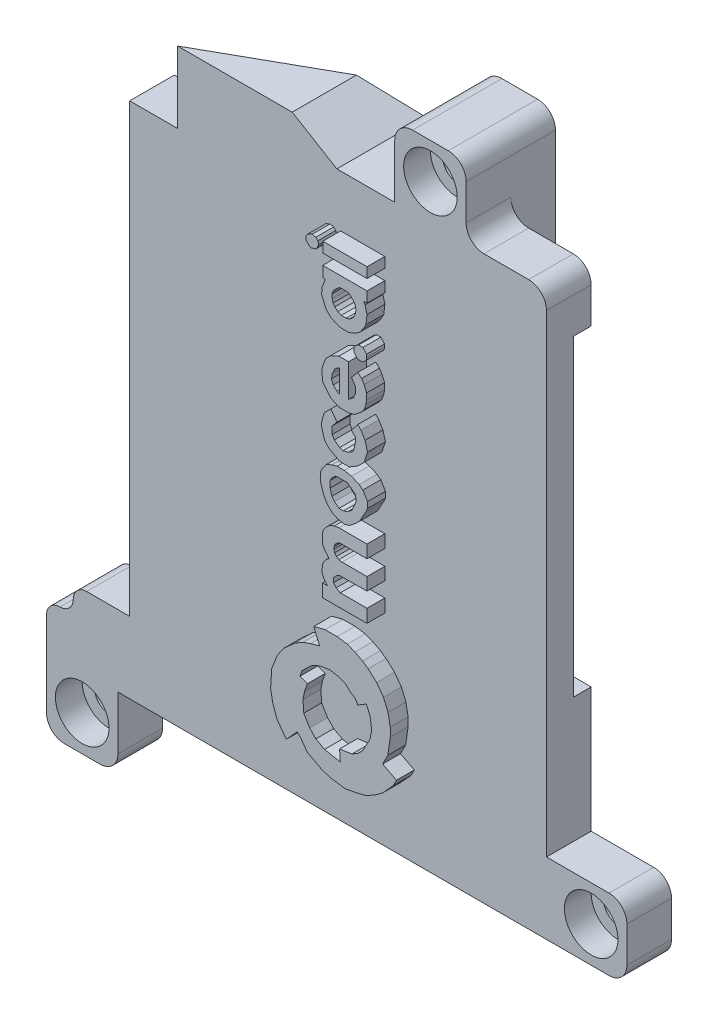
from build123d import *

# Parameters (mm, degrees)
EXTRUDE_1_DEPTH      = 5
SKETCH_2_R           = 1.6
CUT_EXTRUDE_1_DEPTH  = 50.409007276
EXTRUDE_2_DEPTH      = 5
CUT_EXTRUDE_2_DEPTH  = 75.411020689
SKETCH_5_W           = 15.712723141
SKETCH_5_H           = 8
EXTRUDE_3_DEPTH      = 5.633558
CUT_EXTRUDE_3_DEPTH  = 8
SKETCH_7_W           = 0.3
SKETCH_7_H           = 50
CUT_EXTRUDE_4_DEPTH  = 51.162236792
SKETCH_8_W           = 9
SKETCH_8_H           = 5
EXTRUDE_4_DEPTH      = 55
FILLET_1_R           = 2
SKETCH_9_R           = 3
CUT_EXTRUDE_5_DEPTH  = 3
SKETCH_10_R          = 1.6
CUT_EXTRUDE_6_DEPTH  = 50.409007276
SKETCH_11_W          = 8
SKETCH_11_H          = 8
CUT_EXTRUDE_7_DEPTH  = 51.162236792
SKETCH_12_R          = 1.6
EXTRUDE_5_DEPTH      = 5
SKETCH_13_R          = 3
CUT_EXTRUDE_8_DEPTH  = 3
FILLET_2_R           = 2
SKETCH_14_W          = 8.860172008
SKETCH_14_H          = 9.168054433
CUT_EXTRUDE_9_DEPTH  = 57.109268397
FILLET_3_R           = 1.5
SKETCH_17_W          = 4.955155642
SKETCH_17_H          = 1.145782212
EXTRUDE_6_DEPTH      = 2
SKETCH_18_W          = 2
SKETCH_18_H          = 35
CUT_EXTRUDE_10_DEPTH = 72.254824398


with BuildPart() as part:
    # 草图1 → 凸台-拉伸1 (new body)
    with BuildSketch(Plane.XY):
        Polygon((-34, -35.5), (-34, -27.5), (-21.979228204, -27.5), (-21.979228204, 22.5), (-6.266505063, 22.5), (-6.266505063, 30.5), (-3.479228204, 30.5), (1.520771796, 27.5), (8, 27.5), (8, 35.5), (16, 35.5), (16, 22.5), (16, -27.5), (34, -27.5), (34, -35.5), align=None)
    extrude(amount=EXTRUDE_1_DEPTH)

    # 草图2 → 切除-拉伸1 (cut, through all)
    with BuildSketch(Plane.XY.offset(5)):
        with Locations((12, 31.5)):
            Circle(SKETCH_2_R)
        with Locations((30, -31.5)):
            Circle(SKETCH_2_R)
        with Locations((-30, -31.5)):
            Circle(SKETCH_2_R)
    extrude(amount=-CUT_EXTRUDE_1_DEPTH, mode=Mode.SUBTRACT)

    # 草图3 → 凸台-拉伸2 (add)
    with BuildSketch(Plane(origin=(0, 0, 0), x_dir=(-1, 0, 0), z_dir=(0, 0, -1))):
        Polygon((-8, 35.5), (-8, 27.5), (-1.520771796, 27.5), (3.479228204, 30.5), (6.266505063, 30.5), (6.266505063, 22.5), (-16, 22.5), (-16, 35.5), align=None)
    extrude(amount=EXTRUDE_2_DEPTH)

    # 草图4 → 切除-拉伸2 (cut, through all)
    with BuildSketch(Plane(origin=(0, 30.5, 0), x_dir=(1, 0, 0), z_dir=(0, 1, 0))):
        Polygon((-6.266505063, 5), (1.520771796, 5), (-6.266505063, 0.633557637), align=None)
    extrude(amount=-CUT_EXTRUDE_2_DEPTH, mode=Mode.SUBTRACT)

    # 草图5 → 凸台-拉伸3 (add)
    with BuildSketch(Plane.XY.offset(5)):
        with Locations((-14.122866634, 26.5)):
            Rectangle(SKETCH_5_W, SKETCH_5_H)
    extrude(amount=-EXTRUDE_3_DEPTH)

    # 草图6 → 切除-拉伸3 (cut)
    with BuildSketch(Plane(origin=(0, 30.5, 0), x_dir=(1, 0, 0), z_dir=(0, 1, 0))):
        Polygon((-6.266505063, 0.633557637), (-16.313602761, -5), (-21.979228204, -5), (-21.979228204, 0.633557637), align=None)
    extrude(amount=-CUT_EXTRUDE_3_DEPTH, mode=Mode.SUBTRACT)

    # 草图7 → 切除-拉伸4 (cut, through all)
    with BuildSketch(Plane.XY.offset(5)):
        with Locations((-21.829228204, -2.5)):
            Rectangle(SKETCH_7_W, SKETCH_7_H)
    extrude(amount=-CUT_EXTRUDE_4_DEPTH, mode=Mode.SUBTRACT)

    # 草图8 → 凸台-拉伸4 (add)
    with BuildSketch(Plane(origin=(0, -27.5, 0), x_dir=(1, 0, 0), z_dir=(0, 1, 0))):
        with Locations((20.5, -2.5)):
            Rectangle(SKETCH_8_W, SKETCH_8_H)
    extrude(amount=EXTRUDE_4_DEPTH)

    # 圆角1
    fillet_1_edges = [part.edges().sort_by_distance(p)[0] for p in [
        (16, 27.5, 2.5),
        (25, 27.5, 2.5),
        (-34, -35.5, 2.5),
        (-34, -27.5, 2.5),
        (8, 35.5, 0),
        (16, 35.5, 0),
        (34, -27.5, 2.5),
        (34, -35.5, 2.5),
    ]]
    fillet(fillet_1_edges, radius=FILLET_1_R)

    # 草图9 → 切除-拉伸5 (cut)
    with BuildSketch(Plane.XY.offset(5)):
        with Locations((12, 31.5)):
            Circle(SKETCH_9_R)
        with Locations((30, -31.5)):
            Circle(SKETCH_9_R)
        with Locations((-30, -31.5)):
            Circle(SKETCH_9_R)
    extrude(amount=-CUT_EXTRUDE_5_DEPTH, mode=Mode.SUBTRACT)

    # 草图10 → 切除-拉伸6 (cut, through all)
    with BuildSketch(Plane.XY):
        with Locations((12, 31.5)):
            Circle(SKETCH_10_R)
    extrude(amount=-CUT_EXTRUDE_6_DEPTH, mode=Mode.SUBTRACT)

    # 草图11 → 切除-拉伸7 (cut, through all)
    with BuildSketch(Plane.XY.offset(5)):
        with Locations((-30, -31.5)):
            Rectangle(SKETCH_11_W, SKETCH_11_H)
    extrude(amount=-CUT_EXTRUDE_7_DEPTH, mode=Mode.SUBTRACT)

    # 草图12 → 凸台-拉伸5 (add)
    with BuildSketch(Plane.XY.offset(5)):
        Polygon((-26, -27.5), (-31, -27.5), (-31, -35.5), (-31, -43.5), (-23, -43.5), (-23, -35.5), (-26, -35.5), align=None)
        with Locations((-27, -39.5)):
            Circle(SKETCH_12_R, mode=Mode.SUBTRACT)
    extrude(amount=-EXTRUDE_5_DEPTH)

    # 草图13 → 切除-拉伸8 (cut)
    with BuildSketch(Plane.XY.offset(5)):
        with Locations((-27, -39.5)):
            Circle(SKETCH_13_R)
    extrude(amount=-CUT_EXTRUDE_8_DEPTH, mode=Mode.SUBTRACT)

    # 圆角2
    fillet_2_edges = [part.edges().sort_by_distance(p)[0] for p in [
        (-23, -43.5, 2.5),
        (-31, -43.5, 2.5),
        (-31, -27.5, 2.5),
    ]]
    fillet(fillet_2_edges, radius=FILLET_2_R)

    # 草图14 → 切除-拉伸9 (cut, through all)
    with BuildSketch(Plane.XY.offset(5)):
        with Locations((-32.430086004, -25.915972784)):
            Rectangle(SKETCH_14_W, SKETCH_14_H)
    extrude(amount=-CUT_EXTRUDE_9_DEPTH, mode=Mode.SUBTRACT)

    # 圆角3
    fillet_3_edges = [part.edges().sort_by_distance(p)[0] for p in [
        (-28, -27.5, 2.5),
        (-28, -30.5, 2.5),
        (-31, -30.5, 2.5),
    ]]
    fillet(fillet_3_edges, radius=FILLET_3_R - 0.0001)  # a hair under: the kernel refuses the full size

    # 草图17 → 凸台-拉伸6 (add)
    # profile 1 of 9: a face of its own
    with BuildSketch(Plane.XY.offset(5)):
        Polygon((1.916725491, -12.893336586), (6.896323701, -12.893336586), (6.896323701, -11.425665534), (3.908564775, -11.425665534), (3.436813366, -11.181053693), (3.157256975, -10.81413593), (3.157256975, -10.307439971), (3.401851814, -10.062845132), (3.609235388, -9.855461559), (3.856081017, -9.787813418), (6.896323701, -9.760466133), (6.896323701, -8.352080986), (4.097648696, -8.352080986), (3.732658202, -8.297386418), (3.468661155, -8.12418695), (3.279554395, -7.846156225), (3.196343161, -7.542521431), (3.196343161, -7.299210537), (3.327366852, -7.002948289), (3.54844414, -6.781871001), (3.827670109, -6.629325934), (4.270600773, -6.629325934), (6.896323701, -6.629325934), (6.896323701, -5.196364207), (3.763688789, -5.196364207), (3.261855006, -5.251539885), (2.770526588, -5.468564218), (2.47188533, -5.70531219), (2.208746178, -5.968451342), (2.037497209, -6.229475367), (1.916725491, -6.598417429), (1.916725491, -7.64573516), (2.087613264, -8.032613526), (2.319191646, -8.324733702), (2.55250635, -8.619044128), (2.644073756, -8.734550102), (2.319191646, -8.99210052), (2.087613264, -9.291819658), (1.950419501, -9.602033272), (1.881365905, -10.062845132), (1.881365905, -10.543601194), (1.992752729, -10.795773434), (2.136693517, -11.059249708), (2.319191646, -11.289458526), (2.481632701, -11.451899581), (1.937059317, -11.451899581), align=None)
    # profile 2 of 9: a face of its own
    with BuildSketch(Plane.XY.offset(5)):
        Polygon((1.689539286, -1.386065269), (1.689539286, -0.822293818), (1.916725491, -0.308595149), (2.340315754, 0.239634385), (2.96296205, 0.514663046), (3.54844414, 0.675114642), (4.367309759, 0.675114642), (5.160011728, 0.514663046), (5.601366876, 0.319471182), (6.016149805, 0.136031035), (6.436098366, -0.188442767), (6.705339108, -0.637614597), (6.95556609, -1.055065946), (6.95556609, -1.717064592), (6.775331396, -2.12459956), (6.296104273, -2.976689803), (6.051760196, -3.411146024), (5.674152379, -3.788753841), (4.922747903, -4.384430029), (4.367309759, -4.536648069), (3.574830934, -4.376241641), (3.016190797, -4.129179811), (2.47188533, -3.584874344), (2.037497209, -2.860188678), (1.803132388, -2.12459956), (1.65321642, -1.577561596), align=None)
        Polygon((3.261855006, -0.452935376), (2.892496564, -0.822293818), (2.770526588, -1.098084393), (2.770526588, -1.830858835), (2.96296205, -2.533048901), (3.261855006, -2.910081774), (3.763688789, -3.297824299), (4.270600773, -3.297824299), (4.685484077, -3.184125368), (5.208815427, -2.769254239), (5.46855241, -2.181953868), (5.674152379, -1.717064592), (5.601366876, -1.055065946), (5.160011728, -0.714052317), (4.685484077, -0.34740791), (4.049135441, -0.34740791), (3.437905496, -0.34740791), align=None, mode=Mode.SUBTRACT)
    # profile 3 of 9: a face of its own
    with BuildSketch(Plane.XY.offset(5)):
        Polygon((3.54844414, 4.961813382), (2.831511576, 5.866174424), (2.128520622, 5.163183471), (1.916725491, 4.516176589), (1.777120035, 3.780168243), (1.98404045, 3.025123105), (2.173300936, 2.4311007), (2.651638902, 1.952762735), (3.827670109, 1.291346816), (4.922747903, 1.291346816), (5.862956287, 1.854922684), (6.570718737, 2.562685134), (6.783223226, 3.211859012), (6.95556609, 3.738344293), (6.676970982, 4.754927805), (6.216837512, 5.522564196), (5.862956287, 5.876445421), (5.156264653, 4.961813382), (5.601901446, 4.516176589), (5.601901446, 4.110514016), (5.467633562, 3.402645674), (5.326048934, 2.970122847), (4.829657462, 2.672577899), (4.198496866, 2.499608091), (3.827670109, 2.620996757), (3.239654505, 3.075327777), (2.997901377, 3.478642275), (2.997901377, 4.313345303), align=None)
    # profile 4 of 9: a face of its own
    with BuildSketch(Plane.XY.offset(5)):
        Polygon((5.156264653, 10.095922375), (5.862956287, 10.928313604), (6.296104273, 10.560575396), (6.570718737, 10.102438638), (6.862989177, 9.440758121), (6.862989177, 8.770820487), (6.763633365, 8.247010683), (6.570718737, 7.657681311), (6.216837512, 7.240855056), (5.50961047, 6.680200546), (4.829657462, 6.493859158), (3.827670109, 6.493859158), (2.831511576, 6.934416026), (2.365268166, 7.522549969), (1.941168059, 8.057523038), (1.86274235, 8.770820487), (1.86274235, 9.35426087), (2.066993988, 9.978223351), (2.303111977, 10.512117989), (2.831511576, 11.040517587), (3.189977858, 11.198855479), (3.743520469, 11.443360399), (4.375209006, 11.443360399), (4.829657462, 11.443360399), (4.829657462, 7.790036504), (5.379083049, 8.22559385), (5.601901446, 8.729416315), (5.601901446, 9.440758121), align=None)
        Polygon((3.827670109, 10.331507017), (3.827670109, 7.790036504), (3.54844414, 7.913525802), (3.118777941, 8.343192001), (2.906822115, 8.823045663), (3.012800028, 9.381767583), (3.251345884, 9.921151955), (3.54844414, 10.218250212), align=None, mode=Mode.SUBTRACT)
    # profile 5 of 9: a face of its own
    with BuildSketch(Plane.XY.offset(5)):
        Polygon((6.173932235, 13.637407163), (6.433411505, 13.637407163), (6.602078719, 13.46873995), (6.862989177, 13.207829492), (6.862989177, 12.877095512), (6.805301293, 12.572961528), (6.602078719, 12.369738953), (6.350689369, 12.198746194), (5.862956287, 12.205626466), (5.637759627, 12.430823126), (5.437643783, 12.72502852), (5.437643783, 13.207829492), (5.681976013, 13.452161722), (5.954319304, 13.637407163), align=None)
    # profile 6 of 9: a face of its own
    with BuildSketch(Plane.XY.offset(5)):
        Polygon((1.941168059, 19.352732582), (6.896323701, 19.352732582), (6.896323701, 18.162013399), (6.515265359, 18.162013399), (6.676970982, 17.891950509), (6.763633365, 17.564804989), (6.896323701, 17.063906587), (6.829978533, 16.502262669), (6.770282187, 15.996904244), (6.515265359, 15.52942153), (6.113695785, 14.970386362), (5.681976013, 14.642256058), (5.298450141, 14.481247947), (4.861658728, 14.297878413), (4.097648696, 14.297878413), (3.626743322, 14.38956318), (2.831511576, 14.757261852), (2.303111977, 15.309289662), (2.108039589, 15.773957606), (1.813810013, 16.474820774), (1.86274235, 17.235636709), (2.066993988, 17.710486525), (2.249402045, 18.134553784), (1.964868169, 18.134553784), align=None)
        Polygon((3.189977858, 17.564804989), (3.568902331, 17.943729462), (3.809614068, 18.134553784), (4.059364737, 18.162013399), (4.442061473, 18.162013399), (4.740055905, 18.162013399), (5.050776392, 17.958160274), (5.298450141, 17.710486525), (5.50961047, 17.444122316), (5.617237634, 17.178775797), (5.653227712, 16.851438873), (5.600902946, 16.502262669), (5.404030305, 16.05710706), (5.120880851, 15.773957606), (4.895416148, 15.620598556), (4.562714464, 15.52942153), (4.013083488, 15.537174973), (3.626743322, 15.708036144), (3.286494109, 15.996904244), (3.094149291, 16.279684865), (2.997901377, 16.630890033), (2.948719797, 17.078206304), (3.077175785, 17.368662628), align=None, mode=Mode.SUBTRACT)
    # profile 7 of 9: a face of its own
    with BuildSketch(Plane.XY.offset(5)):
        Polygon((0.753718371, 21.776071394), (1.165680205, 21.695862871), (1.392442696, 21.458960342), (1.482254234, 21.119926942), (1.343801067, 20.798047219), (1.165680205, 20.550080659), (0.930466091, 20.487771336), (0.583214376, 20.395782728), (0.368412321, 20.550080659), (0.080431583, 20.850938904), (0.080431583, 21.289443642), (0.2872865, 21.577411606), (0.518497113, 21.674476203), align=None)
    # profile 8 of 9: a face of its own
    with BuildSketch(Plane.XY.offset(5)):
        with Locations((4.41874588, 21.122971765)):
            Rectangle(SKETCH_17_W, SKETCH_17_H)
    # profile 9 of 9: a face of its own
    with BuildSketch(Plane.XY.offset(5)):
        Polygon((1.588200642, -17.733821336), (0.930466091, -16.173680015), (2.208746178, -15.849494805), (3.54844414, -15.849494805), (4.685484077, -16.01158741), (5.535885857, -16.345903407), (6.402528379, -16.791658071), (7.028433692, -17.227281946), (7.970596958, -18.088398909), (8.740536831, -19.131870053), (9.247390739, -20.334123644), (9.500345916, -21.654436216), (9.500345916, -22.609486509), (9.391406404, -23.373670514), (9.22746164, -24.523702895), (8.644063606, -25.657953604), (10.194567977, -26.455450307), (9.826681153, -27.170701073), (9.288856787, -27.759144203), (8.644063606, -28.464623801), (7.897459776, -29.015515947), (6.796699595, -29.647827015), (5.862956287, -29.884634091), (4.46847195, -30.151799639), (2.96296205, -29.937179191), (1.916725491, -29.647827015), (0.224421952, -28.740069874), (-0.576882963, -27.654090844), (-0.931828748, -27.32967803), (-2.140581327, -28.652195557), (-3.171938882, -27.25443466), (-3.653960445, -25.897918766), (-3.899272874, -24.617497915), (-3.776616659, -22.609486509), (-3.150308448, -21.016342233), (-2.420080075, -19.96714855), (-1.650811541, -19.266214882), (-1.180554257, -18.837731006), (-0.270702691, -18.315083817), (0.583214376, -18.011654685), align=None)
        Polygon((-0.616713743, -21.777379466), (0.224421952, -22.082177076), (-0.098198742, -22.972498305), (-0.270702691, -23.858501938), (-0.184450717, -25.140103568), (0.475813349, -26.242803764), (1.165680205, -26.963519093), (2.136693517, -27.493217254), (2.96296205, -27.654090844), (3.908564775, -27.838198671), (3.825446591, -26.603161429), (5.208815427, -26.405452461), (5.862956287, -26.013772379), (6.402528379, -25.497295362), (6.796699595, -24.774722535), (7.220380513, -23.998054158), (7.420055128, -22.972498305), (7.241142706, -21.72064882), (6.824140787, -20.755172848), (5.862956287, -21.330701525), (5.535885857, -20.784464577), (5.03054601, -20.508796279), (4.46847195, -19.9215882), (3.825446591, -19.688578719), (2.770526588, -19.483186935), (1.651186861, -19.643161265), (0.756840233, -20.029441474), (0.224421952, -20.539070881), (-0.376388476, -21.114165076), align=None, mode=Mode.SUBTRACT)
    extrude(amount=EXTRUDE_6_DEPTH)

    # 草图18 → 切除-拉伸10 (cut, through all)
    with BuildSketch(Plane(origin=(25, 0, 0), x_dir=(0, 0, -1), z_dir=(1, 0, 0))):
        with Locations((-1, 4)):
            Rectangle(SKETCH_18_W, SKETCH_18_H)
    extrude(amount=-CUT_EXTRUDE_10_DEPTH, mode=Mode.SUBTRACT)


solid = part.part
